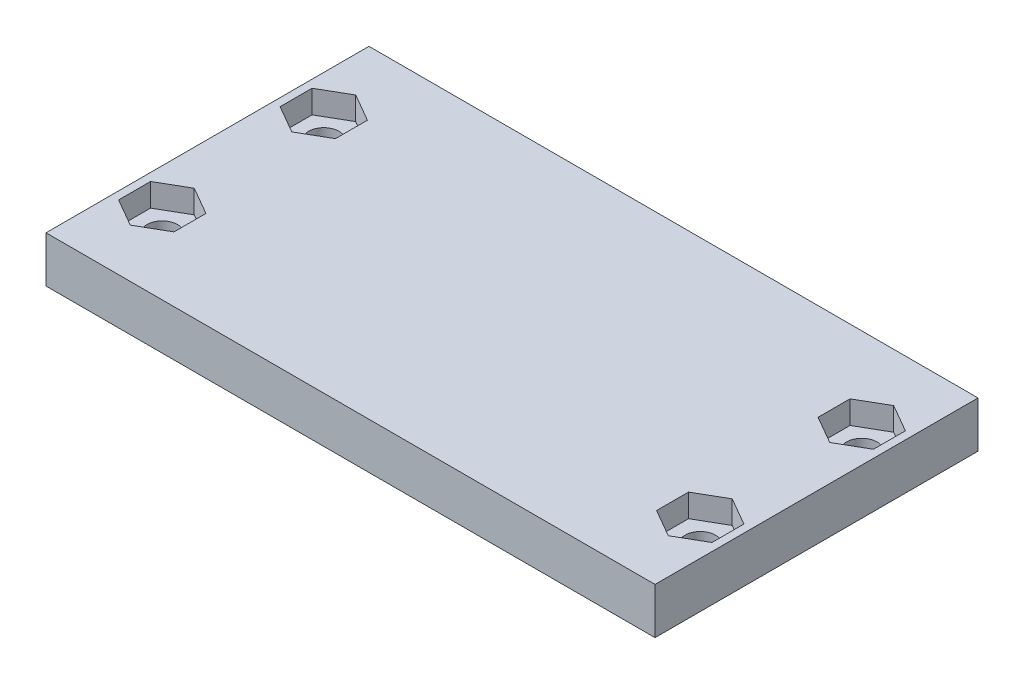
from build123d import *

# Parameters (mm, degrees)
SKETCH1_W           = 66
SKETCH1_H           = 35
BOSS_EXTRUDE1_DEPTH = 5
CUT_EXTRUDE1_DEPTH  = 2.5
SKETCH3_R           = 1.65
CUT_EXTRUDE3_DEPTH  = 75.873226189


with BuildPart() as part:
    # Sketch1 → Boss-Extrude1 (new body)
    with BuildSketch(Plane(origin=(0, 0, 0), x_dir=(1, 0, 0), z_dir=(0, 1, 0))):
        with Locations((33, 17.5)):
            Rectangle(SKETCH1_W, SKETCH1_H)
    extrude(amount=BOSS_EXTRUDE1_DEPTH)

    # Sketch2 → Cut-Extrude1 (cut)
    with BuildSketch(Plane(origin=(0, 5, 0), x_dir=(1, 0, 0), z_dir=(0, 1, 0))):
        Polygon((65.15, 7.017949192), (62.15, 5.285898385), (59.15, 7.017949192), (59.15, 10.482050808), (62.15, 12.214101615), (65.15, 10.482050808), align=None)
        Polygon((3.85, 29.714101615), (0.85, 27.982050808), (0.85, 24.517949192), (3.85, 22.785898385), (6.85, 24.517949192), (6.85, 27.982050808), align=None)
        Polygon((3.85, 5.285898385), (6.85, 7.017949192), (6.85, 10.482050808), (3.85, 12.214101615), (0.85, 10.482050808), (0.85, 7.017949192), align=None)
        Polygon((59.15, 27.982050808), (62.15, 29.714101615), (65.15, 27.982050808), (65.15, 24.517949192), (62.15, 22.785898385), (59.15, 24.517949192), align=None)
    extrude(amount=-CUT_EXTRUDE1_DEPTH, mode=Mode.SUBTRACT)

    # Sketch3 → Cut-Extrude3 (cut, through all)
    with BuildSketch(Plane(origin=(0, 5, 0), x_dir=(1, 0, 0), z_dir=(0, 1, 0))):
        with Locations((3.85, 8.75)):
            Circle(SKETCH3_R)
        with Locations((3.85, 26.25)):
            Circle(SKETCH3_R)
        with Locations((62.15, 26.25)):
            Circle(SKETCH3_R)
        with Locations((62.15, 8.75)):
            Circle(SKETCH3_R)
    extrude(amount=-CUT_EXTRUDE3_DEPTH, mode=Mode.SUBTRACT)


solid = part.part
